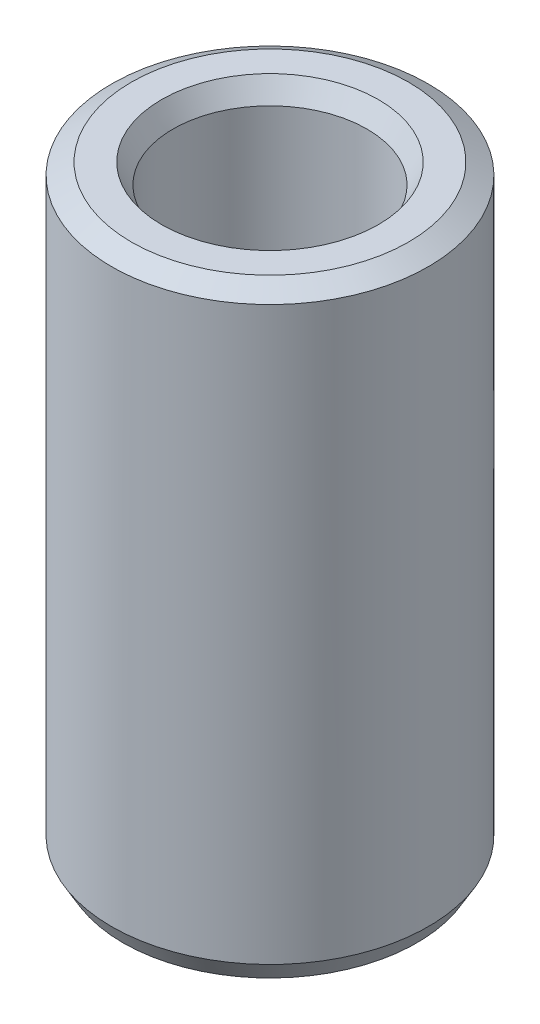
from build123d import *
from OCP.BRepFilletAPI import BRepFilletAPI_MakeChamfer

# Parameters (mm, degrees)
SKETCH1_R           = 35
BOSS_EXTRUDE1_DEPTH = 133.217558853
SKETCH2_R           = 21.429882133
CUT_EXTRUDE1_DEPTH  = 143.115861138
CHAMFER1_SIZE       = 2.526308441
CHAMFER1_SIZE2      = 4.375694576


with BuildPart() as part:
    # Sketch1 → Boss-Extrude1 (new body)
    with BuildSketch(Plane(origin=(0, 0, 0), x_dir=(1, 0, 0), z_dir=(0, 1, 0))):
        Circle(SKETCH1_R)
    extrude(amount=BOSS_EXTRUDE1_DEPTH)

    # Sketch2 → Cut-Extrude1 (cut, through all)
    with BuildSketch(Plane(origin=(0, 0, 0), x_dir=(1, 0, 0), z_dir=(0, 1, 0))):
        Circle(SKETCH2_R)
    extrude(amount=CUT_EXTRUDE1_DEPTH, mode=Mode.SUBTRACT)

    # Chamfer1: one chamfer whose edges measure the first distance from different faces: ONE call of the kernel's chamfer builder (chamfer() names one face for all edges)
    chamfer1_edges_1 = [part.edges().sort_by_distance(p)[0] for p in [
        (-21.429882133, 133.217558853, 0),
    ]]
    chamfer1_side_1 = [part.faces().sort_by_distance(p)[0] for p in [
        (-34.010050506, 133.217558853, 0),
    ]]
    chamfer1_edges_2 = [part.edges().sort_by_distance(p)[0] for p in [
        (-21.429882133, 0, 0),
    ]]
    chamfer1_side_2 = [part.faces().sort_by_distance(p)[0] for p in [
        (-21.429882133, 66.608779427, 0),
    ]]
    chamfer1_edges_3 = [part.edges().sort_by_distance(p)[0] for p in [
        (-35, 0, 0),
    ]]
    chamfer1_side_3 = [part.faces().sort_by_distance(p)[0] for p in [
        (-34.010050506, 0, 0),
    ]]
    chamfer1_edges_4 = [part.edges().sort_by_distance(p)[0] for p in [
        (-35, 133.217558853, 0),
    ]]
    chamfer1_side_4 = [part.faces().sort_by_distance(p)[0] for p in [
        (-35, 66.608779427, 0),
    ]]
    chamfer1 = BRepFilletAPI_MakeChamfer(part.part.solid().wrapped)
    for e in chamfer1_edges_1:
        chamfer1.Add(CHAMFER1_SIZE, CHAMFER1_SIZE2, e.wrapped, chamfer1_side_1[0].wrapped)  # the first distance lies on this face
    for e in chamfer1_edges_2:
        chamfer1.Add(CHAMFER1_SIZE, CHAMFER1_SIZE2, e.wrapped, chamfer1_side_2[0].wrapped)  # the first distance lies on this face
    for e in chamfer1_edges_3:
        chamfer1.Add(CHAMFER1_SIZE, CHAMFER1_SIZE2, e.wrapped, chamfer1_side_3[0].wrapped)  # the first distance lies on this face
    for e in chamfer1_edges_4:
        chamfer1.Add(CHAMFER1_SIZE, CHAMFER1_SIZE2, e.wrapped, chamfer1_side_4[0].wrapped)  # the first distance lies on this face
    add(Compound.cast(chamfer1.Shape()), mode=Mode.REPLACE)


solid = part.part
